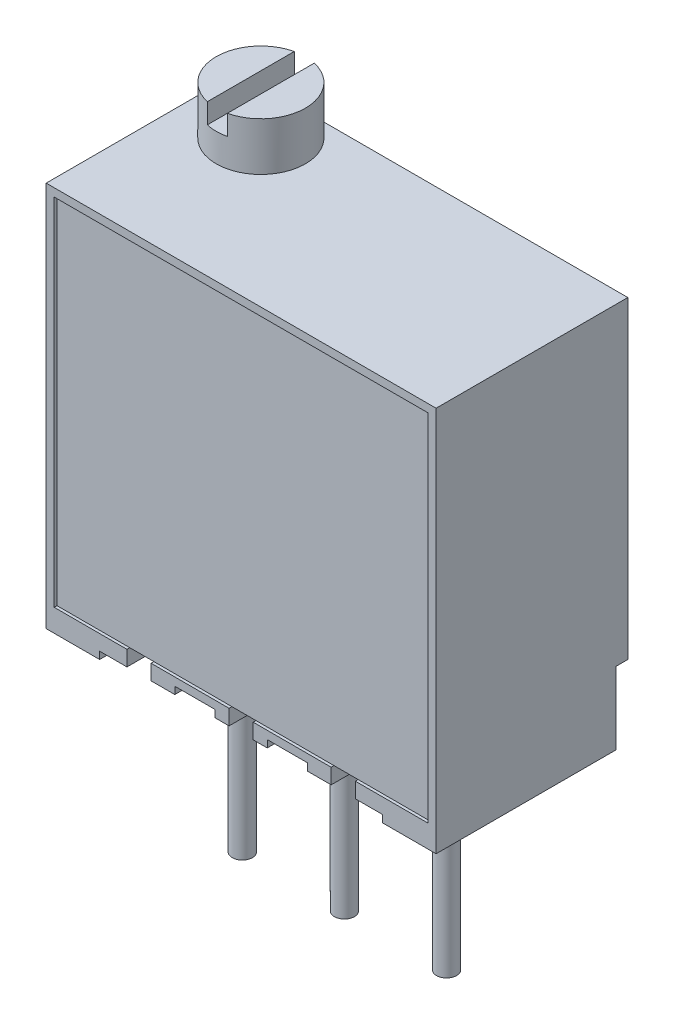
from build123d import *

# Parameters (mm, degrees)
BOSS_EXTRUDE1_DEPTH = 0.4
SKETCH3_W           = 9.3
SKETCH3_H           = 8.84
BOSS_EXTRUDE2_DEPTH = 4.77
SKETCH4_W           = 9.7
SKETCH4_H           = 1.8
CUT_EXTRUDE1_DEPTH  = 0.3
SKETCH5_W           = 0.6
SKETCH5_H           = 4.37
CUT_EXTRUDE2_DEPTH  = 0.5
SKETCH6_W           = 9.3
SKETCH6_H           = 8.84
BOSS_EXTRUDE4_DEPTH = 4.3
SKETCH7_R           = 0.25
BOSS_EXTRUDE5_DEPTH = 5.5
SKETCH8_R           = 1.11
BOSS_EXTRUDE6_DEPTH = 1.2
SKETCH10_W          = 0.5
SKETCH10_H          = 2.435688528
CUT_EXTRUDE3_DEPTH  = 0.5
BOSS_EXTRUDE7_DEPTH = 0.01


# Read off the part's stored shape, not the designer's step: Boss-Extrude7
with BuildPart() as part:
    # Sketch2 → Boss-Extrude1 (new body)
    with BuildSketch(Plane.XY):
        Polygon((-70.552196336, -26.510396318), (-72.422196336, -26.510396318), (-72.422196336, -26.330396318), (-73.422196336, -26.330396318), (-73.422196336, -26.510396318), (-74.722196336, -26.510396318), (-74.722196336, -26.330396318), (-75.722196336, -26.330396318), (-75.722196336, -26.510396318), (-77.592196336, -26.510396318), (-77.592196336, -26.690396318), (-78.922196336, -26.690396318), (-78.922196336, -17.090396318), (-69.222196336, -17.090396318), (-69.222196336, -26.690396318), (-70.552196336, -26.690396318), align=None)
    extrude(amount=BOSS_EXTRUDE1_DEPTH)

    # Sketch3 → Boss-Extrude2 (add)
    with BuildSketch(Plane.XY):
        Polygon((-70.552196336, -26.510396318), (-72.422196336, -26.510396318), (-72.422196336, -26.330396318), (-73.422196336, -26.330396318), (-73.422196336, -26.510396318), (-74.722196336, -26.510396318), (-74.722196336, -26.330396318), (-75.722196336, -26.330396318), (-75.722196336, -26.510396318), (-77.592196336, -26.510396318), (-77.592196336, -26.690396318), (-78.922196336, -26.690396318), (-78.922196336, -17.090396318), (-69.222196336, -17.090396318), (-69.222196336, -26.690396318), (-70.552196336, -26.690396318), align=None)
        with Locations((-74.072196336, -21.710396318)):
            Rectangle(SKETCH3_W, SKETCH3_H, mode=Mode.SUBTRACT)
    extrude(amount=BOSS_EXTRUDE2_DEPTH)

    # Sketch4 → Cut-Extrude1 (cut)
    with BuildSketch(Plane(origin=(0, 0, 0), x_dir=(-1, 0, 0), z_dir=(0, 0, -1))):
        with Locations((74.072196336, -25.790396318)):
            Rectangle(SKETCH4_W, SKETCH4_H)
    extrude(amount=-CUT_EXTRUDE1_DEPTH, mode=Mode.SUBTRACT)

    # Sketch5 → Cut-Extrude2 (cut)
    with BuildSketch(Plane.XZ.offset(26.510396318)):
        with Locations((-76.612196336, 2.585)):
            Rectangle(SKETCH5_W, SKETCH5_H)
        with Locations((-74.072196336, 2.585)):
            Rectangle(SKETCH5_W, SKETCH5_H)
        with Locations((-71.532196336, 2.585)):
            Rectangle(SKETCH5_W, SKETCH5_H)
    extrude(amount=-CUT_EXTRUDE2_DEPTH, mode=Mode.SUBTRACT)

    # Sketch6 → Boss-Extrude4 (add)
    with BuildSketch(Plane.XY.offset(0.4)):
        with Locations((-74.072196336, -21.710396318)):
            Rectangle(SKETCH6_W, SKETCH6_H)
    extrude(amount=BOSS_EXTRUDE4_DEPTH)

    # Sketch7 → Boss-Extrude5 (add)
    with BuildSketch(Plane.XZ.offset(26.130396318)):
        with Locations(Location((-74.072196336, 2.2, 0), (0, 0, 90))):
            Circle(SKETCH7_R)
        with Locations(Location((-71.532196336, 2.2, 0), (0, 0, 90))):
            Circle(SKETCH7_R)
        with Locations(Location((-76.612196336, 2.2, 0), (0, 0, 90))):
            Circle(SKETCH7_R)
    extrude(amount=BOSS_EXTRUDE5_DEPTH)

    # Sketch8 → Boss-Extrude6 (add)
    with BuildSketch(Plane(origin=(0, -17.090396318, 0), x_dir=(1, 0, 0), z_dir=(0, 1, 0))):
        with Locations(Location((-77.222196336, -1.13, 0), (0, 0, 90))):
            Circle(SKETCH8_R)
    extrude(amount=BOSS_EXTRUDE6_DEPTH)

    # Sketch10 → Cut-Extrude3 (cut)
    with BuildSketch(Plane(origin=(0, -15.890396318, 0), x_dir=(1, 0, 0), z_dir=(0, 1, 0))):
        with Locations((-77.222196336, -1.111157834)):
            Rectangle(SKETCH10_W, SKETCH10_H)
    extrude(amount=-CUT_EXTRUDE3_DEPTH, mode=Mode.SUBTRACT)

    # Boss-Extrude7 outline → Boss-Extrude7 (add)
    # profile 1 of 13: a face of its own
    with BuildSketch(Plane(origin=(0, 0, 0), x_dir=(-1, 0, 0), z_dir=(0, 0, -1))):
        with BuildLine():
            add(Edge.make_bspline(
                [(72.340125095, -17.804928971), (72.352423787, -17.805144492), (72.377861366, -17.805590258), (72.416971051, -17.8088329), (72.458231851, -17.814121921), (72.501525147, -17.821188955), (72.54680001, -17.831247243), (72.594395422, -17.84233219), (72.643926679, -17.856359088), (72.677573208, -17.866570009), (72.694789617, -17.87179478)],
                knots=[0, 0, 0, 0, 0.101849446, 0.21065682, 0.324780112, 0.446321564, 0.573782175, 0.708789866, 0.850992279, 1, 1, 1, 1], degree=3))
            add(Edge.make_bspline(
                [(71.658024911, -18.743807647), (71.65845753, -18.709088334), (71.659301393, -18.641365131), (71.668675308, -18.542504017), (71.68282684, -18.448826905), (71.703099236, -18.360415936), (71.72918235, -18.277334411), (71.761454973, -18.199818061), (71.798853898, -18.127277561), (71.84265742, -18.060932565), (71.890980803, -18.001079587), (71.943272037, -17.948407655), (71.999711729, -17.903780699), (72.060572392, -17.867960947), (72.124808688, -17.839121322), (72.193238835, -17.819251029), (72.265490285, -17.807357921), (72.314918597, -17.805749303), (72.340125095, -17.804928971)],
                knots=[0, 0, 0, 0, 0.080061943, 0.156168157, 0.228844023, 0.298465766, 0.365181654, 0.429457503, 0.491925243, 0.553152951, 0.612504578, 0.669097068, 0.724021252, 0.777970074, 0.831597692, 0.886020896, 0.941875134, 1, 1, 1, 1], degree=3))
            add(Edge.make_bspline(
                [(72.238792374, -19.6137525), (72.215878288, -19.613181397), (72.171278955, -19.612069817), (72.10660133, -19.600788148), (72.045823358, -19.584032197), (71.989442529, -19.559025947), (71.936863902, -19.527728549), (71.889176003, -19.488393006), (71.844886863, -19.443089407), (71.80572039, -19.390227548), (71.77091592, -19.330992431), (71.740542309, -19.265401058), (71.714862129, -19.19362872), (71.693810416, -19.115598258), (71.67795623, -19.031441917), (71.66621221, -18.941119773), (71.659413722, -18.844555712), (71.658497018, -18.778055527), (71.658024911, -18.743807647)],
                knots=[0, 0, 0, 0, 0.058175818, 0.113231778, 0.166371554, 0.218014363, 0.269489351, 0.321381642, 0.374653602, 0.430128355, 0.4881141, 0.548985266, 0.613542863, 0.681608133, 0.754159011, 0.831007674, 0.912968228, 1, 1, 1, 1], degree=3))
            add(Edge.make_bspline(
                [(72.783024911, -19.006445515), (72.782581882, -19.028065318), (72.781714435, -19.070396758), (72.774313251, -19.132438659), (72.762244734, -19.191437873), (72.74586529, -19.247789341), (72.723838756, -19.300928003), (72.697820372, -19.35166115), (72.666142537, -19.39888682), (72.63047099, -19.4429387), (72.591011276, -19.482820612), (72.548457052, -19.517741959), (72.503459825, -19.547732696), (72.455563653, -19.572026395), (72.404944268, -19.590569836), (72.35185697, -19.604151208), (72.296134805, -19.612131784), (72.258119326, -19.613206247), (72.238792374, -19.6137525)],
                knots=[0, 0, 0, 0, 0.070999703, 0.139016977, 0.204889692, 0.26865518, 0.331449463, 0.393567594, 0.455637556, 0.517879377, 0.579524525, 0.639588689, 0.698414135, 0.756811896, 0.815559813, 0.875147837, 0.936525547, 1, 1, 1, 1], degree=3))
            add(Edge.make_bspline(
                [(72.296352117, -18.466693677), (72.313036194, -18.467149067), (72.345876655, -18.468045445), (72.394120784, -18.475383916), (72.44030734, -18.487930122), (72.484666653, -18.505285533), (72.527188562, -18.527298012), (72.567451801, -18.554605142), (72.605940954, -18.586519318), (72.642042638, -18.623031543), (72.674822934, -18.663213017), (72.704198096, -18.705583238), (72.728084421, -18.750694764), (72.748436431, -18.797474335), (72.763971922, -18.846693641), (72.774719747, -18.898089026), (72.782101144, -18.951545424), (72.782713237, -18.987922501), (72.783024911, -19.006445515)],
                knots=[0, 0, 0, 0, 0.061857972, 0.121759464, 0.180471547, 0.239027248, 0.298109272, 0.357673356, 0.419105717, 0.483284515, 0.547773767, 0.611241342, 0.674155797, 0.73676504, 0.800238337, 0.865176507, 0.931348594, 1, 1, 1, 1], degree=3))
            add(Edge.make_bspline(
                [(71.90067197, -18.699000662), (71.913476305, -18.680531078), (71.938388057, -18.64459718), (71.981529766, -18.597382435), (72.026846915, -18.556716664), (72.075289711, -18.523752416), (72.126708989, -18.498259277), (72.180663883, -18.479854965), (72.237666574, -18.468936458), (72.276543949, -18.467450684), (72.296352117, -18.466693677)],
                knots=[0, 0, 0, 0, 0.140435538, 0.273227392, 0.398971949, 0.520557125, 0.638505117, 0.756905417, 0.876142401, 1, 1, 1, 1], degree=3))
            add(Edge.make_bspline(
                [(72.362183918, -17.981399559), (72.344214361, -17.9818224), (72.309184969, -17.982646675), (72.25834698, -17.992199234), (72.21037558, -18.006243576), (72.165959347, -18.027424994), (72.124335293, -18.053710898), (72.086431513, -18.086562771), (72.051199336, -18.124815983), (72.019749814, -18.169118297), (71.991463493, -18.218520299), (71.967027613, -18.272929583), (71.946397509, -18.332111219), (71.929612187, -18.3960884), (71.916533927, -18.464960443), (71.907587279, -18.538659992), (71.901372964, -18.617208166), (71.900910367, -18.671184272), (71.90067197, -18.699000662)],
                knots=[0, 0, 0, 0, 0.056174596, 0.109505311, 0.161380562, 0.212218304, 0.262996229, 0.31503079, 0.368734862, 0.425422813, 0.484703583, 0.546669109, 0.611839936, 0.680663917, 0.753521569, 0.831090576, 0.912953145, 1, 1, 1, 1], degree=3))
            add(Edge.make_bspline(
                [(72.694789617, -18.07101353), (72.677823699, -18.063914173), (72.644992176, -18.050175883), (72.596799112, -18.031749719), (72.551139381, -18.016764971), (72.508431142, -18.003586933), (72.468048312, -17.994183575), (72.430532087, -17.986626003), (72.395489371, -17.982307266), (72.372993703, -17.981694169), (72.362183918, -17.981399559)],
                knots=[0, 0, 0, 0, 0.15921502, 0.308104268, 0.446494289, 0.575199069, 0.694854214, 0.805260221, 0.906422206, 1, 1, 1, 1], degree=3))
            Line((72.694789617, -18.07101353), (72.694789617, -17.87179478))
        make_face()
        with BuildLine():
            add(Edge.make_bspline(
                [(71.929624176, -19.00816886), (71.929829325, -19.024153108), (71.930230155, -19.055383767), (71.935076832, -19.100807913), (71.941485872, -19.143930533), (71.952197324, -19.184229791), (71.96468712, -19.222446901), (71.980595247, -19.257974285), (71.999348773, -19.290942314), (72.020591514, -19.321383749), (72.044640058, -19.348444354), (72.070708377, -19.372207935), (72.098824871, -19.392324606), (72.128944805, -19.409027329), (72.161266688, -19.421876729), (72.195571269, -19.43063744), (72.231700888, -19.436461031), (72.256461706, -19.437004174), (72.269123257, -19.437281912)],
                knots=[0, 0, 0, 0, 0.077797601, 0.152004043, 0.222274068, 0.289848813, 0.354777906, 0.41788825, 0.479023545, 0.539248419, 0.598300301, 0.654938887, 0.71067503, 0.766264973, 0.822261639, 0.879526753, 0.938395487, 1, 1, 1, 1], degree=3))
            add(Edge.make_bspline(
                [(72.24430708, -18.643164265), (72.23257748, -18.6435449), (72.209720856, -18.644286616), (72.176265358, -18.648627352), (72.144844954, -18.65680214), (72.114925532, -18.667220935), (72.087154959, -18.681632292), (72.061263529, -18.698989725), (72.036784946, -18.719096079), (72.014641651, -18.742494712), (71.994595688, -18.768318611), (71.977251726, -18.796562012), (71.962502443, -18.826812336), (71.950357235, -18.859112948), (71.94104555, -18.893392409), (71.934653144, -18.929856807), (71.930358004, -18.96831514), (71.929871908, -18.994714682), (71.929624176, -19.00816886)],
                knots=[0, 0, 0, 0, 0.06481384, 0.126298045, 0.185868974, 0.243888158, 0.300941222, 0.358149399, 0.41584485, 0.475547487, 0.535720549, 0.596134117, 0.658295926, 0.721361591, 0.786488521, 0.854210869, 0.925700492, 1, 1, 1, 1], degree=3))
            add(Edge.make_bspline(
                [(72.562436676, -19.05504386), (72.562184526, -19.040098143), (72.561690856, -19.010836686), (72.557459031, -18.967992132), (72.55068366, -18.927305148), (72.541023302, -18.888791533), (72.528581667, -18.852635636), (72.513817707, -18.818442931), (72.495750388, -18.786664642), (72.475142285, -18.757189049), (72.452660148, -18.730273041), (72.427937304, -18.707020409), (72.401712641, -18.687131523), (72.373477695, -18.671207434), (72.343634183, -18.658682863), (72.312039419, -18.649781759), (72.278755398, -18.644006376), (72.25593549, -18.643448529), (72.24430708, -18.643164265)],
                knots=[0, 0, 0, 0, 0.076885384, 0.150529966, 0.221280074, 0.288952767, 0.354570002, 0.417833701, 0.480305304, 0.542293973, 0.602695122, 0.660403836, 0.716562731, 0.771628251, 0.826741347, 0.882688273, 0.940221111, 1, 1, 1, 1], degree=3))
            add(Edge.make_bspline(
                [(72.269123257, -19.437281912), (72.279711567, -19.436937641), (72.300426605, -19.436264108), (72.330757295, -19.431357835), (72.359607319, -19.423092087), (72.386931014, -19.411181988), (72.4130163, -19.396415386), (72.437301904, -19.377821714), (72.460058844, -19.356079752), (72.480995077, -19.331102461), (72.500294733, -19.303804806), (72.516715847, -19.27396811), (72.531056781, -19.242329692), (72.542675604, -19.208636403), (72.551661559, -19.17300455), (72.557767098, -19.135406985), (72.561606623, -19.095909355), (72.562156458, -19.068839643), (72.562436676, -19.05504386)],
                knots=[0, 0, 0, 0, 0.058928597, 0.115288283, 0.170548519, 0.225556492, 0.28085003, 0.33700612, 0.395362716, 0.45571793, 0.518174906, 0.58116666, 0.645003459, 0.711347813, 0.779291422, 0.849319338, 0.92320725, 1, 1, 1, 1], degree=3))
        make_face(mode=Mode.SUBTRACT)
    # profile 2 of 13: a face of its own
    with BuildSketch(Plane(origin=(0, 0, 0), x_dir=(-1, 0, 0), z_dir=(0, 0, -1))):
        with BuildLine():
            add(Edge.make_bspline(
                [(71.141256635, -21.935068143), (71.117558847, -21.934321014), (71.068022043, -21.932759249), (70.990743537, -21.922020016), (70.907409368, -21.905179992), (70.85038336, -21.889472119), (70.820714356, -21.88129976)],
                knots=[0, 0, 0, 0, 0.218059405, 0.455821695, 0.716879564, 1, 1, 1, 1], degree=3))
            add(Edge.make_bspline(
                [(71.703067297, -21.384976231), (71.702653098, -21.404304866), (71.701838617, -21.442312702), (71.693961762, -21.497923536), (71.68168586, -21.551092147), (71.664009762, -21.601714955), (71.641099611, -21.649814655), (71.613350674, -21.695509488), (71.580888161, -21.738887004), (71.543263656, -21.778868627), (71.502395385, -21.815579759), (71.458255651, -21.847559366), (71.411556772, -21.874506297), (71.36236783, -21.896674421), (71.310643346, -21.914000276), (71.256402351, -21.926392677), (71.199592633, -21.933722422), (71.160924305, -21.93461444), (71.141256635, -21.935068143)],
                knots=[0, 0, 0, 0, 0.0659139, 0.129613125, 0.191227705, 0.251851681, 0.312170718, 0.372676713, 0.433986268, 0.496670228, 0.55969524, 0.621169997, 0.682288767, 0.743345908, 0.8049555, 0.868097437, 0.932911088, 1, 1, 1, 1], degree=3))
            add(Edge.make_bspline(
                [(71.019243768, -20.810068143), (71.044881551, -20.810512117), (71.094999701, -20.811380024), (71.168044597, -20.818693429), (71.237083034, -20.830690182), (71.301928356, -20.847463316), (71.362761014, -20.869098522), (71.419107337, -20.896314227), (71.471814801, -20.927475698), (71.519732353, -20.963846514), (71.562916694, -21.00397956), (71.600376176, -21.048139514), (71.632479383, -21.095613079), (71.658293503, -21.146878247), (71.678447219, -21.201591651), (71.692803225, -21.259601467), (71.701677452, -21.321168054), (71.702596159, -21.363346153), (71.703067297, -21.384976231)],
                knots=[0, 0, 0, 0, 0.076228016, 0.149014722, 0.218048924, 0.284427145, 0.347974325, 0.409713019, 0.470241108, 0.529758874, 0.588255853, 0.645215017, 0.701597427, 0.758285424, 0.815469579, 0.87463523, 0.935709531, 1, 1, 1, 1], degree=3))
            Line((71.019243768, -20.810068143), (71.019243768, -20.368891672))
            Line((71.019243768, -20.368891672), (71.65894965, -20.368891672))
            Line((71.65894965, -20.368891672), (71.65894965, -20.17036226))
            Line((71.65894965, -20.17036226), (70.84277318, -20.17036226))
            Line((70.84277318, -20.17036226), (70.84277318, -20.991364099))
            add(Edge.make_bspline(
                [(70.946863253, -20.986538731), (70.930886106, -20.986715394), (70.896134925, -20.987099647), (70.861489876, -20.989868337), (70.84277318, -20.991364099)],
                knots=[0, 0, 0, 0, 0.459758394, 1, 1, 1, 1], degree=3))
            add(Edge.make_bspline(
                [(71.460420238, -21.36981079), (71.460014795, -21.354283063), (71.459227887, -21.324145901), (71.453396568, -21.280448398), (71.443368601, -21.239760298), (71.429427172, -21.201995737), (71.410678443, -21.16751039), (71.388834524, -21.135634764), (71.362469021, -21.107055441), (71.332339354, -21.081357515), (71.297790143, -21.058999137), (71.259551054, -21.039218791), (71.216931186, -21.023321635), (71.170769904, -21.009238725), (71.120260648, -20.999333441), (71.065971495, -20.991661), (71.007714357, -20.987208732), (70.967550844, -20.986766512), (70.946863253, -20.986538731)],
                knots=[0, 0, 0, 0, 0.063745116, 0.123720426, 0.180581812, 0.235516481, 0.288487971, 0.341354337, 0.393774762, 0.447652168, 0.50351868, 0.562379858, 0.624052675, 0.690019359, 0.760329436, 0.835113112, 0.915069369, 1, 1, 1, 1], degree=3))
            add(Edge.make_bspline(
                [(71.136086599, -21.758597554), (71.147594725, -21.758275785), (71.170270749, -21.757641759), (71.203573558, -21.752335958), (71.235296247, -21.743662141), (71.265684737, -21.732072568), (71.293927272, -21.716266421), (71.320920617, -21.697545215), (71.345899013, -21.674883793), (71.369704335, -21.649620373), (71.390923472, -21.621332451), (71.409634865, -21.591044353), (71.425112444, -21.558577461), (71.438316999, -21.52455441), (71.448342148, -21.488529907), (71.454983104, -21.450648606), (71.459801838, -21.410949076), (71.460211033, -21.383727928), (71.460420238, -21.36981079)],
                knots=[0, 0, 0, 0, 0.060920594, 0.120040118, 0.178047063, 0.234880596, 0.291792241, 0.349015272, 0.408487547, 0.470048919, 0.532597626, 0.595418003, 0.658279618, 0.722800704, 0.788493135, 0.855920905, 0.926337835, 1, 1, 1, 1], degree=3))
            add(Edge.make_bspline(
                [(70.820714356, -21.68208101), (70.836647546, -21.688155546), (70.867553204, -21.699938341), (70.913083975, -21.715423289), (70.956162208, -21.728649447), (70.996915235, -21.739221276), (71.034987859, -21.748160271), (71.07083244, -21.753828834), (71.10415889, -21.758106653), (71.125734185, -21.758438382), (71.136086599, -21.758597554)],
                knots=[0, 0, 0, 0, 0.156819045, 0.304182394, 0.442235088, 0.571153594, 0.691382431, 0.801692269, 0.90484656, 1, 1, 1, 1], degree=3))
            Line((70.820714356, -21.68208101), (70.820714356, -21.88129976))
        make_face()
    # profile 3 of 13: a face of its own
    with BuildSketch(Plane(origin=(0, 0, 0), x_dir=(-1, 0, 0), z_dir=(0, 0, -1))):
        with BuildLine():
            add(Edge.make_bspline(
                [(70.774832414, -24.47699262), (70.74631515, -24.476252296), (70.688437618, -24.474749762), (70.600646292, -24.464759769), (70.510958047, -24.448259698), (70.451213245, -24.43257316), (70.42085723, -24.424602914)],
                knots=[0, 0, 0, 0, 0.238373614, 0.483793821, 0.737718399, 1, 1, 1, 1], degree=3))
            add(Edge.make_bspline(
                [(71.369386642, -23.9537849), (71.368977619, -23.973342451), (71.36818034, -24.011464568), (71.360377386, -24.067127615), (71.347684403, -24.119671897), (71.330026171, -24.169238824), (71.307644865, -24.215946119), (71.279410491, -24.259116073), (71.246469796, -24.299315814), (71.208882163, -24.336301673), (71.166781466, -24.369057665), (71.121517113, -24.398520637), (71.072120294, -24.422413824), (71.019495343, -24.442628551), (70.96323432, -24.45798676), (70.903497043, -24.468861949), (70.840380761, -24.476069604), (70.797026825, -24.476680091), (70.774832414, -24.47699262)],
                knots=[0, 0, 0, 0, 0.065602291, 0.127873789, 0.188191635, 0.246729609, 0.304153522, 0.361583907, 0.419394847, 0.478287293, 0.538143713, 0.598145253, 0.659187064, 0.721915258, 0.787114069, 0.854569931, 0.925549213, 1, 1, 1, 1], degree=3))
            add(Edge.make_bspline(
                [(71.007484069, -23.487792253), (71.022151023, -23.493119133), (71.050890852, -23.503557131), (71.091825181, -23.522069183), (71.130377997, -23.541376634), (71.165503654, -23.563486437), (71.198425549, -23.586281468), (71.228197016, -23.611304939), (71.255192612, -23.63790543), (71.279462763, -23.666154648), (71.300548041, -23.696373397), (71.318900118, -23.728195904), (71.334456572, -23.761766532), (71.347160458, -23.796963307), (71.35725547, -23.833830619), (71.364451971, -23.872322155), (71.368614929, -23.912561846), (71.369126216, -23.939873549), (71.369386642, -23.9537849)],
                knots=[0, 0, 0, 0, 0.073550112, 0.144121109, 0.211718454, 0.276665446, 0.339641767, 0.40040287, 0.459778888, 0.51818565, 0.575747176, 0.633265349, 0.691192801, 0.749972709, 0.809506682, 0.871238107, 0.934414494, 1, 1, 1, 1], degree=3))
            add(Edge.make_bspline(
                [(71.325268995, -23.058334532), (71.324950113, -23.070060576), (71.324320391, -23.093216908), (71.320942296, -23.127466535), (71.314850228, -23.160607472), (71.305520209, -23.192475522), (71.2948504, -23.223589612), (71.28081868, -23.253156583), (71.264844772, -23.281809679), (71.246342185, -23.309397643), (71.224721386, -23.335447985), (71.20124182, -23.36089151), (71.175052172, -23.384950771), (71.146145003, -23.407659626), (71.115272726, -23.429807029), (71.081724446, -23.450456251), (71.045608711, -23.46982579), (71.020407773, -23.481701881), (71.007484069, -23.487792253)],
                knots=[0, 0, 0, 0, 0.061868365, 0.12217628, 0.181374544, 0.239318465, 0.297211647, 0.354697305, 0.411682352, 0.470181498, 0.529627454, 0.59009353, 0.652717279, 0.716988198, 0.783921692, 0.853050129, 0.924640236, 1, 1, 1, 1], degree=3))
            add(Edge.make_bspline(
                [(70.830668811, -22.668169091), (70.849522464, -22.668503333), (70.886259346, -22.669154614), (70.93978412, -22.674107859), (70.990199891, -22.681732553), (71.037385773, -22.693324561), (71.081587742, -22.707518987), (71.122433539, -22.725511614), (71.159963111, -22.746789092), (71.194555629, -22.770668336), (71.225091477, -22.797972787), (71.252182088, -22.827570171), (71.274875937, -22.859899052), (71.293313625, -22.89493774), (71.307911743, -22.932112502), (71.317773864, -22.972104786), (71.324154933, -23.014355461), (71.324892953, -23.043489794), (71.325268995, -23.058334532)],
                knots=[0, 0, 0, 0, 0.079420864, 0.154753826, 0.226296479, 0.294037353, 0.359245731, 0.421663612, 0.481703209, 0.540788876, 0.598392699, 0.653908669, 0.70950477, 0.764287872, 0.820379066, 0.877318085, 0.937490219, 1, 1, 1, 1], degree=3))
            add(Edge.make_bspline(
                [(70.442916054, -22.735724238), (70.474806205, -22.72525061), (70.537998179, -22.704496577), (70.635140017, -22.683960792), (70.732627917, -22.670436355), (70.797994779, -22.668924701), (70.830668811, -22.668169091)],
                knots=[0, 0, 0, 0, 0.254494305, 0.50429354, 0.752218048, 1, 1, 1, 1], degree=3))
            Line((70.442916054, -22.735724238), (70.442916054, -22.938734348))
            add(Edge.make_bspline(
                [(70.812056679, -22.844639679), (70.797338404, -22.84487556), (70.767719011, -22.845350251), (70.723079588, -22.850185919), (70.677816383, -22.857304919), (70.631895942, -22.867733083), (70.585362252, -22.881300537), (70.538202256, -22.897503648), (70.490382988, -22.916421975), (70.45892482, -22.931209245), (70.442916054, -22.938734348)],
                knots=[0, 0, 0, 0, 0.114897565, 0.231222484, 0.350256178, 0.472581654, 0.598656507, 0.728604909, 0.861889587, 1, 1, 1, 1], degree=3))
            add(Edge.make_bspline(
                [(71.082621936, -23.096937473), (71.08246071, -23.087390928), (71.08214683, -23.068805405), (71.078620259, -23.041671274), (71.072754021, -23.01619315), (71.064856452, -22.99210287), (71.054477393, -22.969717805), (71.041947262, -22.948760763), (71.027124097, -22.929348866), (71.009770719, -22.911905564), (70.990837658, -22.895948397), (70.97017193, -22.88212865), (70.947651078, -22.87069641), (70.923730519, -22.860968029), (70.897977347, -22.85398024), (70.87087444, -22.84817745), (70.841992781, -22.845248299), (70.822172102, -22.844845332), (70.812056679, -22.844639679)],
                knots=[0, 0, 0, 0, 0.068400825, 0.133164948, 0.195696528, 0.255596633, 0.314555167, 0.372181429, 0.430329101, 0.489149424, 0.54819992, 0.607588292, 0.666890945, 0.728981677, 0.792332248, 0.857908165, 0.927483867, 1, 1, 1, 1], degree=3))
            add(Edge.make_bspline(
                [(70.99128462, -23.325108429), (70.998556196, -23.317544367), (71.0129334, -23.302588864), (71.031753924, -23.277982083), (71.047123608, -23.251501527), (71.060513321, -23.22389311), (71.070546775, -23.194368766), (71.077133652, -23.163215866), (71.082008055, -23.130636259), (71.082414386, -23.108330856), (71.082621936, -23.096937473)],
                knots=[0, 0, 0, 0, 0.1244756, 0.246110504, 0.366547156, 0.487315283, 0.609780468, 0.735497176, 0.86489453, 1, 1, 1, 1], degree=3))
            add(Edge.make_bspline(
                [(70.641445466, -23.418169091), (70.653623334, -23.418062079), (70.677176686, -23.417855106), (70.711321801, -23.417426987), (70.742908204, -23.415516413), (70.771866411, -23.413502388), (70.798319523, -23.411159268), (70.822246106, -23.408131936), (70.843664862, -23.404425033), (70.868609994, -23.398436579), (70.897807648, -23.388507473), (70.930716805, -23.371868785), (70.962430676, -23.35092209), (70.981493817, -23.333867595), (70.99128462, -23.325108429)],
                knots=[0, 0, 0, 0, 0.098046135, 0.189632133, 0.274850568, 0.352741993, 0.42333363, 0.488611137, 0.546851876, 0.598224633, 0.695041521, 0.794314607, 0.894360259, 1, 1, 1, 1], degree=3))
            Line((70.641445466, -23.418169091), (70.575268995, -23.418169091))
            Line((70.575268995, -23.418169091), (70.575268995, -23.594639679))
            Line((70.575268995, -23.594639679), (70.687631128, -23.594639679))
            add(Edge.make_bspline(
                [(71.126739583, -23.955163576), (71.126460628, -23.941126155), (71.125916411, -23.913740489), (71.120171055, -23.873933491), (71.111387425, -23.836580434), (71.098852026, -23.801800515), (71.083007141, -23.76938647), (71.063117295, -23.739669714), (71.040009115, -23.712098851), (71.012771096, -23.687780257), (70.982847989, -23.66550436), (70.949394365, -23.646607982), (70.913189721, -23.630363318), (70.873782241, -23.617291536), (70.831485633, -23.606972316), (70.786161497, -23.59996458), (70.737937579, -23.595251924), (70.704761863, -23.594848165), (70.687631128, -23.594639679)],
                knots=[0, 0, 0, 0, 0.065211442, 0.12722128, 0.186548927, 0.243311476, 0.298723825, 0.353826462, 0.409148657, 0.465479929, 0.523162142, 0.582251326, 0.643690464, 0.707361574, 0.774978085, 0.845834725, 0.920394651, 1, 1, 1, 1], degree=3))
            add(Edge.make_bspline(
                [(70.78034712, -24.300522032), (70.792997499, -24.300289182), (70.8178074, -24.299832516), (70.854060492, -24.295316402), (70.88838385, -24.287614344), (70.920952763, -24.277470065), (70.951427776, -24.26376884), (70.980256422, -24.247679998), (71.006971244, -24.228103376), (71.031659662, -24.205789925), (71.054002052, -24.181111692), (71.073488455, -24.154282057), (71.090065765, -24.125663563), (71.103584176, -24.09515492), (71.113906924, -24.062766311), (71.121484446, -24.028637549), (71.12607453, -23.992513279), (71.126514308, -23.96781513), (71.126739583, -23.955163576)],
                knots=[0, 0, 0, 0, 0.068874193, 0.135075955, 0.198532882, 0.26027296, 0.320501122, 0.380184014, 0.439758567, 0.500452968, 0.561147369, 0.620721922, 0.680715605, 0.740943766, 0.802088047, 0.865544974, 0.931125807, 1, 1, 1, 1], degree=3))
            add(Edge.make_bspline(
                [(70.42085723, -24.21918012), (70.439788802, -24.225576506), (70.476278479, -24.237905225), (70.529577641, -24.254524409), (70.579496172, -24.268861569), (70.62624283, -24.280044906), (70.669502906, -24.289357324), (70.709454438, -24.295440276), (70.746026154, -24.29954403), (70.769308365, -24.300207474), (70.78034712, -24.300522032)],
                knots=[0, 0, 0, 0, 0.162004934, 0.312256566, 0.452614144, 0.582969038, 0.701893905, 0.811236697, 0.910501976, 1, 1, 1, 1], degree=3))
            Line((70.42085723, -24.21918012), (70.42085723, -24.424602914))
        make_face()
    # profile 4 of 13: a face of its own
    with BuildSketch(Plane(origin=(0, 0, 0), x_dir=(-1, 0, 0), z_dir=(0, 0, -1))):
        with BuildLine():
            add(Edge.make_bspline(
                [(75.076303003, -24.47699262), (75.047785738, -24.476252296), (74.989908207, -24.474749762), (74.902116881, -24.464759769), (74.812428636, -24.448259698), (74.752683833, -24.43257316), (74.722327819, -24.424602914)],
                knots=[0, 0, 0, 0, 0.238373614, 0.483793821, 0.737718399, 1, 1, 1, 1], degree=3))
            add(Edge.make_bspline(
                [(75.67085723, -23.9537849), (75.670448207, -23.973342451), (75.669650928, -24.011464568), (75.661847974, -24.067127615), (75.649154991, -24.119671897), (75.631496759, -24.169238824), (75.609115453, -24.215946119), (75.580881079, -24.259116073), (75.547940385, -24.299315814), (75.510352751, -24.336301673), (75.468252054, -24.369057665), (75.422987701, -24.398520637), (75.373590882, -24.422413824), (75.320965932, -24.442628551), (75.264704908, -24.45798676), (75.204967631, -24.468861949), (75.141851349, -24.476069604), (75.098497413, -24.476680091), (75.076303003, -24.47699262)],
                knots=[0, 0, 0, 0, 0.065602291, 0.127873789, 0.188191635, 0.246729609, 0.304153522, 0.361583907, 0.419394847, 0.478287293, 0.538143713, 0.598145253, 0.659187064, 0.721915258, 0.787114069, 0.854569931, 0.925549213, 1, 1, 1, 1], degree=3))
            add(Edge.make_bspline(
                [(75.308954657, -23.487792253), (75.323621611, -23.493119133), (75.35236144, -23.503557131), (75.393295769, -23.522069183), (75.431848585, -23.541376634), (75.466974243, -23.563486437), (75.499896137, -23.586281468), (75.529667605, -23.611304939), (75.5566632, -23.63790543), (75.580933351, -23.666154648), (75.60201863, -23.696373397), (75.620370707, -23.728195904), (75.635927161, -23.761766532), (75.648631047, -23.796963307), (75.658726058, -23.833830619), (75.66592256, -23.872322155), (75.670085517, -23.912561846), (75.670596804, -23.939873549), (75.67085723, -23.9537849)],
                knots=[0, 0, 0, 0, 0.073550112, 0.144121109, 0.211718454, 0.276665446, 0.339641767, 0.40040287, 0.459778888, 0.51818565, 0.575747176, 0.633265349, 0.691192801, 0.749972709, 0.809506682, 0.871238107, 0.934414494, 1, 1, 1, 1], degree=3))
            add(Edge.make_bspline(
                [(75.626739583, -23.058334532), (75.626420701, -23.070060576), (75.625790979, -23.093216908), (75.622412885, -23.127466535), (75.616320816, -23.160607472), (75.606990798, -23.192475522), (75.596320988, -23.223589612), (75.582289268, -23.253156583), (75.56631536, -23.281809679), (75.547812773, -23.309397643), (75.526191974, -23.335447985), (75.502712408, -23.36089151), (75.476522761, -23.384950771), (75.447615591, -23.407659626), (75.416743314, -23.429807029), (75.383195034, -23.450456251), (75.347079299, -23.46982579), (75.321878361, -23.481701881), (75.308954657, -23.487792253)],
                knots=[0, 0, 0, 0, 0.061868365, 0.12217628, 0.181374544, 0.239318465, 0.297211647, 0.354697305, 0.411682352, 0.470181498, 0.529627454, 0.59009353, 0.652717279, 0.716988198, 0.783921692, 0.853050129, 0.924640236, 1, 1, 1, 1], degree=3))
            add(Edge.make_bspline(
                [(75.1321394, -22.668169091), (75.150993052, -22.668503333), (75.187729935, -22.669154614), (75.241254708, -22.674107859), (75.291670479, -22.681732553), (75.338856361, -22.693324561), (75.38305833, -22.707518987), (75.423904128, -22.725511614), (75.461433699, -22.746789092), (75.496026217, -22.770668336), (75.526562065, -22.797972787), (75.553652676, -22.827570171), (75.576346525, -22.859899052), (75.594784213, -22.89493774), (75.609382331, -22.932112502), (75.619244452, -22.972104786), (75.625625521, -23.014355461), (75.626363542, -23.043489794), (75.626739583, -23.058334532)],
                knots=[0, 0, 0, 0, 0.079420864, 0.154753826, 0.226296479, 0.294037353, 0.359245731, 0.421663612, 0.481703209, 0.540788876, 0.598392699, 0.653908669, 0.70950477, 0.764287872, 0.820379066, 0.877318085, 0.937490219, 1, 1, 1, 1], degree=3))
            add(Edge.make_bspline(
                [(74.744386642, -22.735724238), (74.776276794, -22.72525061), (74.839468767, -22.704496577), (74.936610605, -22.683960792), (75.034098506, -22.670436355), (75.099465368, -22.668924701), (75.1321394, -22.668169091)],
                knots=[0, 0, 0, 0, 0.254494305, 0.50429354, 0.752218048, 1, 1, 1, 1], degree=3))
            Line((74.744386642, -22.735724238), (74.744386642, -22.938734348))
            add(Edge.make_bspline(
                [(75.113527267, -22.844639679), (75.098808992, -22.84487556), (75.069189599, -22.845350251), (75.024550176, -22.850185919), (74.979286971, -22.857304919), (74.93336653, -22.867733083), (74.88683284, -22.881300537), (74.839672844, -22.897503648), (74.791853577, -22.916421975), (74.760395408, -22.931209245), (74.744386642, -22.938734348)],
                knots=[0, 0, 0, 0, 0.114897565, 0.231222484, 0.350256178, 0.472581654, 0.598656507, 0.728604909, 0.861889587, 1, 1, 1, 1], degree=3))
            add(Edge.make_bspline(
                [(75.384092525, -23.096937473), (75.383931299, -23.087390928), (75.383617418, -23.068805405), (75.380090847, -23.041671274), (75.374224609, -23.01619315), (75.366327041, -22.99210287), (75.355947981, -22.969717805), (75.343417851, -22.948760763), (75.328594685, -22.929348866), (75.311241307, -22.911905564), (75.292308246, -22.895948397), (75.271642519, -22.88212865), (75.249121667, -22.87069641), (75.225201107, -22.860968029), (75.199447935, -22.85398024), (75.172345029, -22.84817745), (75.143463369, -22.845248299), (75.12364269, -22.844845332), (75.113527267, -22.844639679)],
                knots=[0, 0, 0, 0, 0.068400825, 0.133164948, 0.195696528, 0.255596633, 0.314555167, 0.372181429, 0.430329101, 0.489149424, 0.54819992, 0.607588292, 0.666890945, 0.728981677, 0.792332248, 0.857908165, 0.927483867, 1, 1, 1, 1], degree=3))
            add(Edge.make_bspline(
                [(75.292755208, -23.325108429), (75.300026784, -23.317544367), (75.314403988, -23.302588864), (75.333224512, -23.277982083), (75.348594196, -23.251501527), (75.361983909, -23.22389311), (75.372017363, -23.194368766), (75.37860424, -23.163215866), (75.383478644, -23.130636259), (75.383884975, -23.108330856), (75.384092525, -23.096937473)],
                knots=[0, 0, 0, 0, 0.1244756, 0.246110504, 0.366547156, 0.487315283, 0.609780468, 0.735497176, 0.86489453, 1, 1, 1, 1], degree=3))
            add(Edge.make_bspline(
                [(74.942916054, -23.418169091), (74.955093922, -23.418062079), (74.978647275, -23.417855106), (75.01279239, -23.417426987), (75.044378793, -23.415516413), (75.073336999, -23.413502388), (75.099790111, -23.411159268), (75.123716694, -23.408131936), (75.14513545, -23.404425033), (75.170080582, -23.398436579), (75.199278236, -23.388507473), (75.232187393, -23.371868785), (75.263901264, -23.35092209), (75.282964405, -23.333867595), (75.292755208, -23.325108429)],
                knots=[0, 0, 0, 0, 0.098046135, 0.189632133, 0.274850568, 0.352741993, 0.42333363, 0.488611137, 0.546851876, 0.598224633, 0.695041521, 0.794314607, 0.894360259, 1, 1, 1, 1], degree=3))
            Line((74.942916054, -23.418169091), (74.876739583, -23.418169091))
            Line((74.876739583, -23.418169091), (74.876739583, -23.594639679))
            Line((74.876739583, -23.594639679), (74.989101716, -23.594639679))
            add(Edge.make_bspline(
                [(75.428210172, -23.955163576), (75.427931216, -23.941126155), (75.427387, -23.913740489), (75.421641644, -23.873933491), (75.412858013, -23.836580434), (75.400322614, -23.801800515), (75.384477729, -23.76938647), (75.364587883, -23.739669714), (75.341479703, -23.712098851), (75.314241685, -23.687780257), (75.284318577, -23.66550436), (75.250864953, -23.646607982), (75.214660309, -23.630363318), (75.175252829, -23.617291536), (75.132956221, -23.606972316), (75.087632085, -23.59996458), (75.039408167, -23.595251924), (75.006232451, -23.594848165), (74.989101716, -23.594639679)],
                knots=[0, 0, 0, 0, 0.065211442, 0.12722128, 0.186548927, 0.243311476, 0.298723825, 0.353826462, 0.409148657, 0.465479929, 0.523162142, 0.582251326, 0.643690464, 0.707361574, 0.774978085, 0.845834725, 0.920394651, 1, 1, 1, 1], degree=3))
            add(Edge.make_bspline(
                [(75.081817708, -24.300522032), (75.094468087, -24.300289182), (75.119277988, -24.299832516), (75.15553108, -24.295316402), (75.189854438, -24.287614344), (75.222423351, -24.277470065), (75.252898364, -24.26376884), (75.28172701, -24.247679998), (75.308441833, -24.228103376), (75.33313025, -24.205789925), (75.35547264, -24.181111692), (75.374959043, -24.154282057), (75.391536353, -24.125663563), (75.405054764, -24.09515492), (75.415377512, -24.062766311), (75.422955035, -24.028637549), (75.427545118, -23.992513279), (75.427984896, -23.96781513), (75.428210172, -23.955163576)],
                knots=[0, 0, 0, 0, 0.068874193, 0.135075955, 0.198532882, 0.26027296, 0.320501122, 0.380184014, 0.439758567, 0.500452968, 0.561147369, 0.620721922, 0.680715605, 0.740943766, 0.802088047, 0.865544974, 0.931125807, 1, 1, 1, 1], degree=3))
            add(Edge.make_bspline(
                [(74.722327819, -24.21918012), (74.741259391, -24.225576506), (74.777749067, -24.237905225), (74.831048229, -24.254524409), (74.88096676, -24.268861569), (74.927713418, -24.280044906), (74.970973494, -24.289357324), (75.010925026, -24.295440276), (75.047496742, -24.29954403), (75.070778953, -24.300207474), (75.081817708, -24.300522032)],
                knots=[0, 0, 0, 0, 0.162004934, 0.312256566, 0.452614144, 0.582969038, 0.701893905, 0.811236697, 0.910501976, 1, 1, 1, 1], degree=3))
            Line((74.722327819, -24.21918012), (74.722327819, -24.424602914))
        make_face()
    # profile 5 of 13: a face of its own
    with BuildSketch(Plane(origin=(0, 0, 0), x_dir=(-1, 0, 0), z_dir=(0, 0, -1))):
        with BuildLine():
            add(Edge.make_bspline(
                [(77.192916054, -23.571546848), (77.19251326, -23.605225385), (77.191728579, -23.670834508), (77.183883722, -23.766682641), (77.171686168, -23.857277467), (77.154688712, -23.942707047), (77.132084882, -24.022700837), (77.105172834, -24.097703002), (77.072564118, -24.16728687), (77.035580159, -24.231288109), (76.994536062, -24.288933587), (76.949343713, -24.339026306), (76.901091286, -24.381791738), (76.849103107, -24.416775965), (76.793675453, -24.443912705), (76.734766514, -24.462693708), (76.672752718, -24.475085698), (76.630133017, -24.476347781), (76.60835723, -24.47699262)],
                knots=[0, 0, 0, 0, 0.08402611, 0.163691181, 0.239795527, 0.312045946, 0.380844798, 0.447052501, 0.510668818, 0.572331946, 0.63128909, 0.686908255, 0.740336249, 0.791782936, 0.842814953, 0.893767987, 0.945722623, 1, 1, 1, 1], degree=3))
            add(Edge.make_bspline(
                [(76.60835723, -22.668169091), (76.630122016, -22.668864236), (76.672698923, -22.6702241), (76.734882756, -22.681904249), (76.793595465, -22.701383914), (76.849129834, -22.728329139), (76.900967983, -22.763404134), (76.949459759, -22.805768692), (76.994529052, -22.855899402), (77.035475977, -22.91347099), (77.072673728, -22.977239433), (77.105073431, -23.04669406), (77.132168294, -23.121510885), (77.154626616, -23.201321318), (77.171697699, -23.286500042), (77.18390354, -23.376868655), (77.191716346, -23.472489428), (77.192509559, -23.537983353), (77.192916054, -23.571546848)],
                knots=[0, 0, 0, 0, 0.054360063, 0.10634074, 0.157460983, 0.208570743, 0.260095803, 0.313416112, 0.369120007, 0.428166966, 0.48967589, 0.553389121, 0.619427948, 0.688331608, 0.76041069, 0.836346503, 0.916132936, 1, 1, 1, 1], degree=3))
            add(Edge.make_bspline(
                [(76.023798407, -23.571546848), (76.024204902, -23.537983353), (76.024998115, -23.472489428), (76.03281092, -23.376868655), (76.045016762, -23.286500042), (76.062087845, -23.201321318), (76.084546167, -23.121510885), (76.11164103, -23.04669406), (76.144040733, -22.977239433), (76.181238484, -22.91347099), (76.222185409, -22.855899402), (76.267254701, -22.805768692), (76.315746478, -22.763404134), (76.367584627, -22.728329139), (76.423118996, -22.701383914), (76.481831705, -22.681904249), (76.544015538, -22.6702241), (76.586592445, -22.668864236), (76.60835723, -22.668169091)],
                knots=[0, 0, 0, 0, 0.083867064, 0.163653497, 0.23958931, 0.311668392, 0.380572052, 0.446610879, 0.51032411, 0.571833034, 0.630879993, 0.686583888, 0.739904197, 0.791429257, 0.842539017, 0.89365926, 0.945639937, 1, 1, 1, 1], degree=3))
            add(Edge.make_bspline(
                [(76.60835723, -24.47699262), (76.586581444, -24.476347781), (76.543961743, -24.475085698), (76.481947947, -24.462693708), (76.423039008, -24.443912705), (76.367611354, -24.416775965), (76.315623175, -24.381791738), (76.267370748, -24.339026306), (76.222178399, -24.288933587), (76.181134302, -24.231288109), (76.144150343, -24.16728687), (76.111541627, -24.097703002), (76.084629579, -24.022700837), (76.062025749, -23.942707047), (76.045028293, -23.857277467), (76.032830738, -23.766682641), (76.024985882, -23.670834508), (76.024201201, -23.605225385), (76.023798407, -23.571546848)],
                knots=[0, 0, 0, 0, 0.054277377, 0.106232013, 0.157185047, 0.208217064, 0.259663751, 0.313091745, 0.36871091, 0.427668054, 0.489331182, 0.552947499, 0.619155202, 0.687954054, 0.760204473, 0.836308819, 0.91597389, 1, 1, 1, 1], degree=3))
        make_face()
        with BuildLine():
            add(Edge.make_bspline(
                [(76.266445466, -23.571546848), (76.26668327, -23.600964534), (76.267144267, -23.657992383), (76.271440541, -23.740638641), (76.277723567, -23.817590927), (76.28698567, -23.888799408), (76.298892592, -23.954422596), (76.313665288, -24.014384968), (76.330667704, -24.068773066), (76.350655797, -24.117380291), (76.37337512, -24.16041705), (76.398687106, -24.197882937), (76.427079724, -24.22943875), (76.457803504, -24.255683502), (76.49168757, -24.276028952), (76.528339303, -24.290078768), (76.5674758, -24.299155568), (76.594518746, -24.30005948), (76.60835723, -24.300522032)],
                knots=[0, 0, 0, 0, 0.098996637, 0.191910583, 0.278447812, 0.358780693, 0.433481858, 0.50278438, 0.566493908, 0.625087651, 0.679401805, 0.730023057, 0.77684067, 0.821842793, 0.865542037, 0.90912652, 0.953497995, 1, 1, 1, 1], degree=3))
            add(Edge.make_bspline(
                [(76.60835723, -22.844639679), (76.594518265, -22.845101693), (76.567474377, -22.846004553), (76.528344651, -22.855088919), (76.491667861, -22.869110735), (76.457941677, -22.889523401), (76.426830813, -22.915350808), (76.398929689, -22.947253221), (76.373338927, -22.984352014), (76.350586106, -23.027175603), (76.330672662, -23.075701275), (76.313716012, -23.129985207), (76.298884734, -23.189700342), (76.286954831, -23.255093299), (76.277727428, -23.326192779), (76.271452958, -23.403030013), (76.267141986, -23.485445668), (76.266682513, -23.542243989), (76.266445466, -23.571546848)],
                knots=[0, 0, 0, 0, 0.046602101, 0.091069087, 0.134747386, 0.178540694, 0.223390965, 0.270598086, 0.321009123, 0.37509844, 0.433818307, 0.497664971, 0.566740556, 0.641221472, 0.721727271, 0.808450774, 0.901177713, 1, 1, 1, 1], degree=3))
            add(Edge.make_bspline(
                [(76.950268995, -23.571546848), (76.949975715, -23.542247286), (76.949407299, -23.485460878), (76.945858831, -23.40299603), (76.938830965, -23.326218084), (76.929844061, -23.255077187), (76.917658614, -23.189772535), (76.903565295, -23.129855507), (76.885914183, -23.075781387), (76.866193241, -23.02714132), (76.843286046, -22.984494119), (76.818199192, -22.94701806), (76.789853019, -22.915478476), (76.758799647, -22.889492417), (76.725117058, -22.869214354), (76.688529422, -22.85495428), (76.649340249, -22.846053855), (76.62219209, -22.84511707), (76.60835723, -22.844639679)],
                knots=[0, 0, 0, 0, 0.098812603, 0.191511835, 0.278260591, 0.358758501, 0.433232118, 0.5022085, 0.566167548, 0.624881661, 0.678965678, 0.7291524, 0.776613383, 0.821459259, 0.865248276, 0.90856161, 0.953402465, 1, 1, 1, 1], degree=3))
            add(Edge.make_bspline(
                [(76.60835723, -24.300522032), (76.622191609, -24.300044103), (76.649338825, -24.299106262), (76.688534793, -24.290213443), (76.725097566, -24.275925541), (76.758937813, -24.255714659), (76.789603858, -24.229309597), (76.818441169, -24.19811795), (76.843248632, -24.160275024), (76.866123701, -24.117414503), (76.885919485, -24.06869313), (76.903616294, -24.014514481), (76.9176502, -23.954350592), (76.929813194, -23.888815438), (76.938835172, -23.81756568), (76.945871345, -23.740672601), (76.949404765, -23.657977202), (76.949974876, -23.600961239), (76.950268995, -23.571546848)],
                knots=[0, 0, 0, 0, 0.046497293, 0.091241685, 0.134461843, 0.17815666, 0.223154224, 0.270226605, 0.320625207, 0.374933859, 0.433521665, 0.497343122, 0.566546887, 0.641240484, 0.721565225, 0.808127366, 0.901013393, 1, 1, 1, 1], degree=3))
        make_face(mode=Mode.SUBTRACT)
    # profile 6 of 13: a face of its own
    with BuildSketch(Plane(origin=(0, 0, 0), x_dir=(-1, 0, 0), z_dir=(0, 0, -1))):
        with BuildLine():
            add(Edge.make_bspline(
                [(78.126280025, -23.752842804), (78.104589867, -23.773545294), (78.062551151, -23.813669762), (78.004701236, -23.8755139), (77.953895026, -23.936928482), (77.909754807, -23.997622449), (77.871544334, -24.057211004), (77.84141628, -24.116749429), (77.816801272, -24.175226153), (77.8059052, -24.214907479), (77.800567708, -24.234345561)],
                knots=[0, 0, 0, 0, 0.152623952, 0.295807659, 0.430830283, 0.558115307, 0.6777099, 0.790712601, 0.897479589, 1, 1, 1, 1], degree=3))
            Line((78.126280025, -23.752842804), (78.224510723, -23.660471481))
            add(Edge.make_bspline(
                [(78.516445466, -23.135885083), (78.515657686, -23.158344027), (78.514094107, -23.202920396), (78.501295414, -23.268690431), (78.479984089, -23.332129309), (78.45572805, -23.38322616), (78.431868772, -23.423565978), (78.410676509, -23.454792584), (78.387128949, -23.487282474), (78.35977334, -23.519943979), (78.330382303, -23.554075508), (78.297762861, -23.588943181), (78.262393205, -23.624721917), (78.237336265, -23.648368063), (78.224510723, -23.660471481)],
                knots=[0, 0, 0, 0, 0.108728641, 0.215803912, 0.323157955, 0.432193812, 0.48907978, 0.550049666, 0.614944499, 0.683352426, 0.756334284, 0.833121306, 0.914582165, 1, 1, 1, 1], degree=3))
            add(Edge.make_bspline(
                [(77.989446385, -22.668169091), (78.00876195, -22.668581936), (78.04656505, -22.669389927), (78.101797517, -22.675237586), (78.154159641, -22.685201455), (78.203689388, -22.69930806), (78.250273479, -22.717630405), (78.294072673, -22.739646269), (78.334526637, -22.766161575), (78.37216268, -22.795922497), (78.405738484, -22.82944767), (78.435796314, -22.865239315), (78.460601701, -22.904188767), (78.481191011, -22.945508223), (78.496973951, -22.989494104), (78.508488974, -23.036007872), (78.514930715, -23.085153294), (78.515933804, -23.118748594), (78.516445466, -23.135885083)],
                knots=[0, 0, 0, 0, 0.073052595, 0.142973527, 0.20979125, 0.274437045, 0.337461703, 0.398874708, 0.459503201, 0.520108329, 0.580028755, 0.638673404, 0.696533539, 0.754253161, 0.812950917, 0.872921747, 0.935179172, 1, 1, 1, 1], degree=3))
            add(Edge.make_bspline(
                [(77.567916054, -22.761229753), (77.58577485, -22.753827273), (77.621092038, -22.739188281), (77.674614941, -22.720327602), (77.727678463, -22.703983153), (77.780593456, -22.690791735), (77.833220237, -22.680914304), (77.885545693, -22.673629007), (77.93754321, -22.668890284), (77.972202985, -22.668408687), (77.989446385, -22.668169091)],
                knots=[0, 0, 0, 0, 0.133401731, 0.26381252, 0.39148264, 0.516485312, 0.639962224, 0.760845615, 0.881019578, 1, 1, 1, 1], degree=3))
            Line((77.567916054, -22.761229753), (77.567916054, -22.965618539))
            add(Edge.make_bspline(
                [(77.969110907, -22.844639679), (77.954728859, -22.844931768), (77.925160185, -22.845532287), (77.880057833, -22.851967293), (77.832781383, -22.861129378), (77.78374104, -22.874831311), (77.732440186, -22.891839386), (77.679075696, -22.912421585), (77.623948026, -22.937473889), (77.586925168, -22.956070332), (77.567916054, -22.965618539)],
                knots=[0, 0, 0, 0, 0.101973738, 0.20965221, 0.322674563, 0.443496612, 0.570577131, 0.706059354, 0.849078339, 1, 1, 1, 1], degree=3))
            add(Edge.make_bspline(
                [(78.273798407, -23.14519115), (78.273517855, -23.134036933), (78.272972414, -23.112351228), (78.26918212, -23.080599604), (78.26257028, -23.050641473), (78.253796555, -23.022229904), (78.241838855, -22.995707116), (78.227360756, -22.970894364), (78.210370002, -22.94768977), (78.191059166, -22.926220162), (78.169486632, -22.907129672), (78.146098693, -22.890273451), (78.120826678, -22.876214629), (78.093874038, -22.864383456), (78.065084429, -22.855409295), (78.034572598, -22.849346144), (78.002413774, -22.845452902), (77.980381677, -22.8449149), (77.969110907, -22.844639679)],
                knots=[0, 0, 0, 0, 0.06929322, 0.13471787, 0.198278275, 0.25967793, 0.319104319, 0.378599251, 0.437845338, 0.497477119, 0.557640482, 0.616468047, 0.676227839, 0.736960086, 0.79904049, 0.863151557, 0.929993623, 1, 1, 1, 1], degree=3))
            add(Edge.make_bspline(
                [(78.057001532, -23.575338208), (78.074140427, -23.5577616), (78.107407215, -23.523645205), (78.151776211, -23.470106915), (78.189130663, -23.416181271), (78.220145414, -23.362360258), (78.244197541, -23.308327457), (78.261302026, -23.254131771), (78.271678427, -23.199701669), (78.27309523, -23.163271764), (78.273798407, -23.14519115)],
                knots=[0, 0, 0, 0, 0.14886004, 0.288939002, 0.421155337, 0.546309658, 0.665175746, 0.779119415, 0.890374221, 1, 1, 1, 1], degree=3))
            Line((78.057001532, -23.575338208), (77.95222212, -23.679428282))
            add(Edge.make_bspline(
                [(77.523798407, -24.234345561), (77.536342022, -24.211248512), (77.561761454, -24.164442717), (77.604365087, -24.095447966), (77.651538332, -24.026408001), (77.702635275, -23.956847971), (77.758803565, -23.887512868), (77.819082729, -23.81800903), (77.883613379, -23.748158629), (77.929089999, -23.702601404), (77.95222212, -23.679428282)],
                knots=[0, 0, 0, 0, 0.112013238, 0.226992996, 0.345431911, 0.468350861, 0.594770667, 0.72564926, 0.860448851, 1, 1, 1, 1], degree=3))
            Line((77.523798407, -24.234345561), (77.523798407, -24.432874973))
            Line((77.523798407, -24.432874973), (78.516445466, -24.432874973))
            Line((78.516445466, -24.432874973), (78.516445466, -24.234345561))
            Line((78.516445466, -24.234345561), (77.800567708, -24.234345561))
        make_face()
    # profile 7 of 13: a face of its own
    with BuildSketch(Plane(origin=(0, 0, 0), x_dir=(-1, 0, 0), z_dir=(0, 0, -1))):
        Polygon((73.731554323, -19.106399559), (73.731554323, -19.569634853), (73.952142558, -19.569634853), (73.952142558, -19.106399559), (74.172730793, -19.106399559), (74.172730793, -18.929928971), (73.952142558, -18.929928971), (73.952142558, -17.849046618), (73.731554323, -17.849046618), (73.003613146, -18.914074191), (73.003613146, -19.106399559), align=None)
        Polygon((73.731554323, -18.157180809), (73.731554323, -18.929928971), (73.196627852, -18.929928971), align=None, mode=Mode.SUBTRACT)
    # profile 8 of 13: a face of its own
    with BuildSketch(Plane(origin=(0, 0, 0), x_dir=(-1, 0, 0), z_dir=(0, 0, -1))):
        Polygon((75.783024911, -18.069634853), (76.003957815, -19.569634853), (76.26797436, -19.569634853), (76.473741823, -18.683145883), (76.476154507, -18.683145883), (76.680887962, -19.569634853), (76.928705058, -19.569634853), (77.172730793, -18.069634853), (76.999017558, -18.069634853), (76.808760205, -19.300103603), (76.806002852, -19.300103603), (76.595410021, -18.378458383), (76.375511124, -18.378458383), (76.169054323, -19.314235037), (76.158024911, -19.314235037), (75.977418293, -18.069634853), align=None)
    # profile 9 of 13: a face of its own
    with BuildSketch(Plane(origin=(0, 0, 0), x_dir=(-1, 0, 0), z_dir=(0, 0, -1))):
        Polygon((72.122184944, -20.390950496), (72.122184944, -21.890950496), (72.34277318, -21.890950496), (72.34277318, -21.136474393), (73.04555351, -21.890950496), (73.313361415, -21.890950496), (72.596104981, -21.098211525), (73.203067297, -20.390950496), (72.970760312, -20.390950496), (72.34277318, -21.126474393), (72.34277318, -20.390950496), align=None)
    # profile 10 of 13: a face of its own
    with BuildSketch(Plane(origin=(0, 0, 0), x_dir=(-1, 0, 0), z_dir=(0, 0, -1))):
        Polygon((76.423655532, -20.390950496), (76.423655532, -21.890950496), (76.644243768, -21.890950496), (76.644243768, -21.136474393), (77.347024099, -21.890950496), (77.614832003, -21.890950496), (76.897575569, -21.098211525), (77.504537885, -20.390950496), (77.2722309, -20.390950496), (76.644243768, -21.126474393), (76.644243768, -20.390950496), align=None)
    # profile 11 of 13: a face of its own
    with BuildSketch(Plane(origin=(0, 0, 0), x_dir=(-1, 0, 0), z_dir=(0, 0, -1))):
        Polygon((73.244386642, -24.256404385), (73.244386642, -24.432874973), (74.391445466, -24.432874973), (74.391445466, -24.256404385), (73.928210172, -24.256404385), (73.928210172, -22.668169091), (73.244386642, -22.88324262), (73.244386642, -23.025246297), (73.707621936, -22.921845561), (73.707621936, -24.256404385), align=None)
    # profile 12 of 13: a face of its own
    with BuildSketch(Plane(origin=(0, 0, 0), x_dir=(-1, 0, 0), z_dir=(0, 0, -1))):
        Polygon((72.472799804, -23.536772302), (72.689078067, -22.953323964), (71.823965014, -22.953323964), (72.040243278, -23.536772302), align=None)
    # profile 13 of 13: a face of its own
    with BuildSketch(Plane(origin=(0, 0, 0), x_dir=(-1, 0, 0), z_dir=(0, 0, -1))):
        Polygon((72.452598865, -23.587936135), (72.060444217, -23.587936135), (72.256521541, -24.046638844), align=None)
    extrude(amount=BOSS_EXTRUDE7_DEPTH)


solid = part.part
